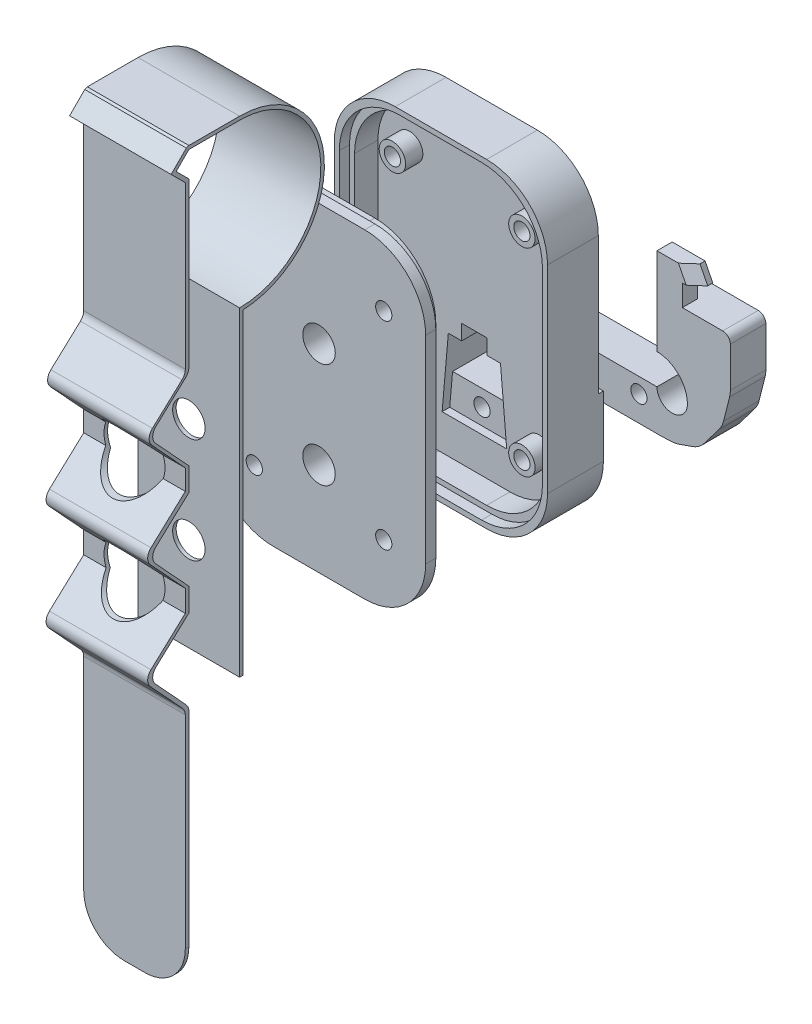
from build123d import *

# Parameters (mm, degrees)
SKETCH_2_W               = 42
SKETCH_2_H               = 63
EXTRUDE_1_DEPTH          = 10
SKETCH_3_W               = 42
SKETCH_3_H               = 24
EXTRUDE_2_DEPTH          = 8
EXTRUDE_3_DEPTH          = 32
SKETCH_5_R               = 0.74
CUT_EXTRUDE_1_DEPTH      = 10
FILLET_1_R               = 3
CUT_EXTRUDE_2_DEPTH      = 7
CUT_EXTRUDE_3_DEPTH      = 7
SKETCH_8_R               = 1.6
CUT_EXTRUDE_4_DEPTH      = 3
FILLET_6_R               = 12
EXTRUDE_START            = -30
SKETCH_10_R              = 1.6
EXTRUDE_7437_DEPTH       = 7
FILLET_2_R               = 1.5
CHAMFER_7825_SIZE        = 1.5
CHAMFER_7825_SIZE_2      = 17.145078454
CUT_EXTRUDE_5_DEPTH      = 6.6
CUT_EXTRUDE_6_DEPTH      = 2
EXTRUDE_START_2          = 20
SKETCH_16_W              = 42
SKETCH_16_H              = 63
EXTRUDE_9_DEPTH          = 4
EXTRUDE_10_DEPTH         = 1
SKETCH_20_W              = 42
SKETCH_20_H              = 63
CUT_EXTRUDE_7_DEPTH      = 2
EXTRUDE_11_DEPTH         = 10
EXTRUDE_11_DEPTH_BACK    = 10
FILLET_3_R               = 2
FILLET_4_R               = 2
CUT_EXTRUDE_8_DEPTH      = 12
CUT_EXTRUDE_8_DEPTH_BACK = 8
SKETCH_22_R              = 6
SKETCH_23_R              = 3.2
CUT_EXTRUDE_10_DEPTH     = 0.7
SKETCH_24_R              = 3.2
CUT_EXTRUDE_11_DEPTH     = 6
FILLET_5_R               = 8
FILLET_7_R               = 12
SKETCH_27_R              = 1.6
CUT_EXTRUDE_13_DEPTH     = 6
SKETCH_28_R              = 1.6
CUT_EXTRUDE_14_DEPTH     = 2
SKETCH_29_R              = 2.6
EXTRUDE_12_DEPTH         = 3.4
SKETCH_32_R              = 1.6
CUT_EXTRUDE_16_DEPTH     = 2.4
CHAMFER_3_SIZE           = 2
EXTRUDE_13_DEPTH         = 1
CUT_EXTRUDE_17_DEPTH     = 11.5
SKETCH_38_W              = 5
SKETCH_38_H              = 5
CUT_EXTRUDE_19_DEPTH     = 3
EXTRUDE_15_DEPTH         = 10
SKETCH_40_R              = 1.6
CUT_EXTRUDE_20_DEPTH     = 10.4
EXTRUDE_16_DEPTH         = 7
EXTRUDE_17_DEPTH         = 7
FILLET_8_R               = 5
SKETCH_43_W              = 4
SKETCH_43_H              = 7.2
CUT_EXTRUDE_21_DEPTH     = 59


with BuildPart() as part:
    # 草图2 → 凸台-拉伸1 (new body)
    with BuildSketch(Plane.XY):
        Rectangle(SKETCH_2_W, SKETCH_2_H)
    extrude(amount=EXTRUDE_1_DEPTH)

    # 草图3 → 凸台-拉伸2 (add)
    with BuildSketch(Plane(origin=(0, 0, 0), x_dir=(-1, 0, 0), z_dir=(0, 0, -1))):
        with Locations((0, -19.5)):
            Rectangle(SKETCH_3_W, SKETCH_3_H)
    extrude(amount=EXTRUDE_2_DEPTH)

    # 草图4 → 凸台-拉伸3 (add)
    with BuildSketch(Plane(origin=(0, -7.5, 0), x_dir=(1, 0, 0), z_dir=(0, 1, 0))):
        Polygon((-3.5, 0), (0, 0), (0, 3), (-5.5, 3), align=None)
        Polygon((0, 3), (0, 0), (3.5, 0), (5.5, 3), align=None)
    extrude(amount=EXTRUDE_3_DEPTH)

    # 草图5 → 切除-拉伸1 (cut)
    with BuildSketch(Plane(origin=(0, -7.5, 0), x_dir=(1, 0, 0), z_dir=(0, 1, 0))):
        with Locations(Location((-3.81, 6.25, 0), (0, 0, 270))):
            Circle(SKETCH_5_R)
        with Locations(Location((-1.27, 6.25, 0), (0, 0, 270))):
            Circle(SKETCH_5_R)
        with Locations(Location((1.27, 6.25, 0), (0, 0, 270))):
            Circle(SKETCH_5_R)
        with Locations(Location((3.81, 6.25, 0), (0, 0, 270))):
            Circle(SKETCH_5_R)
    extrude(amount=-CUT_EXTRUDE_1_DEPTH, mode=Mode.SUBTRACT)

    # 圆角1
    # the kernel refuses this fillet: 3 mm, written as the material it takes off along each edge
    with BuildSketch(Plane(origin=(-9.660251472, 24.5, -9.240377208), x_dir=(0, -1, 0), z_dir=(0.5547001962252293, 0, 0.8320502943378436))) as fillet_1_piece_1_section:
        with BuildLine():
            CenterArc((FILLET_1_R, FILLET_1_R), FILLET_1_R, 180, 90)
            Line((0, FILLET_1_R), (0, 0))
            Line((0, 0), (FILLET_1_R, 0))
        make_face()
    fillet_1_piece_1 = extrude(amount=18.605551275, mode=Mode.PRIVATE)
    fillet_1_piece_1 = split(fillet_1_piece_1, bisect_by=Plane(origin=(-5.864892725, 23.83506759, 0), z_dir=(0, 0, -1)), keep=Keep.TOP, mode=Mode.PRIVATE)
    add(fillet_1_piece_1, mode=Mode.SUBTRACT)
    with BuildSketch(Plane(origin=(-0.660251472, 24.5, 6.240377208), x_dir=(-0.8320502943378437, 0, -0.5547001962252291), z_dir=(0.5547001962252291, 0, -0.8320502943378437))) as fillet_1_piece_2_section:
        with BuildLine():
            CenterArc((FILLET_1_R, -FILLET_1_R), FILLET_1_R, 90, 90)
            Line((0, -FILLET_1_R), (0, 0))
            Line((0, 0), (FILLET_1_R, 0))
        make_face()
    fillet_1_piece_2 = extrude(amount=18.605551275, mode=Mode.PRIVATE)
    fillet_1_piece_2 = split(fillet_1_piece_2, bisect_by=Plane(origin=(5.864892725, 23.83506759, 0), z_dir=(0, 0, -1)), keep=Keep.TOP, mode=Mode.PRIVATE)
    add(fillet_1_piece_2, mode=Mode.SUBTRACT)

    # 草图6 → 切除-拉伸2 (cut)
    with BuildSketch(Plane(origin=(0, 0, -8), x_dir=(-1, 0, 0), z_dir=(0, 0, -1))):
        with BuildLine():
            Line((-17.55, -7.5), (-21, -7.5))
            Line((-21, -7.5), (-21, -17.5))
            Line((-21, -17.5), (-19, -17.5))
            Line((-19, -17.5), (-19, -21.5))
            ThreePointArc((-19, -21.5), (-16.656854249, -27.156854249), (-11, -29.5))
            Line((-11, -29.5), (-9.55, -29.5))
            Line((-9.55, -29.5), (0, -29.5))
            Line((0, -29.5), (9.55, -29.5))
            Line((9.55, -29.5), (11, -29.5))
            ThreePointArc((11, -29.5), (16.656854249, -27.156854249), (19, -21.5))
            Line((19, -21.5), (19, -17.5))
            Line((19, -17.5), (21, -17.5))
            Line((21, -17.5), (21, -7.5))
            Line((21, -7.5), (17.55, -7.5))
            Line((17.55, -7.5), (14.55, -7.5))
            Line((14.55, -7.5), (9.55, -7.5))
            Line((9.55, -7.5), (9.55, -19.5))
            ThreePointArc((9.55, -19.5), (12.378427125, -20.671572875), (13.55, -23.5))
            ThreePointArc((13.55, -23.5), (11.55, -25.5), (9.55, -23.5))
            Line((9.55, -23.5), (0, -23.5))
            Line((0, -23.5), (-9.55, -23.5))
            ThreePointArc((-9.55, -23.5), (-11.55, -25.5), (-13.55, -23.5))
            ThreePointArc((-13.55, -23.5), (-12.378427125, -20.671572875), (-9.55, -19.5))
            Line((-9.55, -19.5), (-9.55, -7.5))
            Line((-9.55, -7.5), (-14.55, -7.5))
            Line((-14.55, -7.5), (-17.55, -7.5))
        make_face()
        with BuildLine():
            Line((-19, -17.5), (-21, -17.5))
            Line((-21, -17.5), (-21, -31.5))
            Line((-21, -31.5), (-9.55, -31.5))
            Line((-9.55, -31.5), (-9.55, -29.5))
            Line((-9.55, -29.5), (-11, -29.5))
            ThreePointArc((-11, -29.5), (-16.656854249, -27.156854249), (-19, -21.5))
            Line((-19, -21.5), (-19, -17.5))
        make_face()
        with BuildLine():
            Line((9.55, -29.5), (9.55, -31.5))
            Line((9.55, -31.5), (21, -31.5))
            Line((21, -31.5), (21, -17.5))
            Line((21, -17.5), (19, -17.5))
            Line((19, -17.5), (19, -21.5))
            ThreePointArc((19, -21.5), (16.656854249, -27.156854249), (11, -29.5))
            Line((11, -29.5), (9.55, -29.5))
        make_face()
        Polygon((-9.55, -29.5), (-9.55, -31.5), (9.55, -31.5), (9.55, -29.5), (0, -29.5), align=None)
    extrude(amount=-CUT_EXTRUDE_2_DEPTH, mode=Mode.SUBTRACT)

    # 草图7 → 切除-拉伸3 (cut)
    with BuildSketch(Plane(origin=(0, 0, -8), x_dir=(-1, 0, 0), z_dir=(0, 0, -1))):
        with BuildLine():
            Line((-7.55, -7.5), (-9.55, -7.5))
            Line((-9.55, -7.5), (-9.55, -19.5))
            ThreePointArc((-9.55, -19.5), (-12.378427125, -20.671572875), (-13.55, -23.5))
            ThreePointArc((-13.55, -23.5), (-12.964213562, -24.914213562), (-11.55, -25.5))
            ThreePointArc((-11.55, -25.5), (-10.135786438, -24.914213562), (-9.55, -23.5))
            Line((-9.55, -23.5), (-7.55, -23.5))
            Line((-7.55, -23.5), (-7.55, -7.5))
        make_face()
        with BuildLine():
            Line((9.55, -7.5), (7.55, -7.5))
            Line((7.55, -7.5), (7.55, -23.5))
            Line((7.55, -23.5), (9.55, -23.5))
            ThreePointArc((9.55, -23.5), (10.135786438, -24.914213562), (11.55, -25.5))
            ThreePointArc((11.55, -25.5), (12.964213562, -24.914213562), (13.55, -23.5))
            ThreePointArc((13.55, -23.5), (12.378427125, -20.671572875), (9.55, -19.5))
            Line((9.55, -19.5), (9.55, -7.5))
        make_face()
    extrude(amount=-CUT_EXTRUDE_3_DEPTH, mode=Mode.SUBTRACT)

    # 草图8 → 切除-拉伸4 (cut)
    with BuildSketch(Plane(origin=(0, 0, -1), x_dir=(-1, 0, 0), z_dir=(0, 0, -1))):
        with Locations((-6, -26.5)):
            Circle(SKETCH_8_R)
        with Locations((6, -26.5)):
            Circle(SKETCH_8_R)
    extrude(amount=-CUT_EXTRUDE_4_DEPTH, mode=Mode.SUBTRACT)

    # 圆角6
    fillet_6_edges = [part.edges().sort_by_distance(p)[0] for p in [
        (21, -31.5, 4.5),
        (-21, -31.5, 4.5),
        (-21, 31.5, 5),
        (21, 31.5, 5),
    ]]
    fillet(fillet_6_edges, radius=FILLET_6_R)

    # Chamfer 7825
    # the kernel refuses this chamfer: 17.145078454, 1.5 mm, written as the material it takes off along each edge
    with BuildSketch(Plane(origin=(7.55, -7.5, -52.570930251), x_dir=(-0.9159861691531067, 0.4012098427509178, 0), z_dir=(0, 0, 1))) as chamfer_7825_piece_1:
        Polygon((CHAMFER_7825_SIZE * 0.915986169153, CHAMFER_7825_SIZE * 0.401209842751), (-CHAMFER_7825_SIZE_2 * 0.401209842754, CHAMFER_7825_SIZE_2 * 0.915986169161), (0, 0), align=None)
    extrude(amount=51.570930251, mode=Mode.SUBTRACT)
    with BuildSketch(Plane(origin=(-7.55, -7.5, -52.570930251), x_dir=(0.9159861691531067, 0.4012098427509178, 0), z_dir=(0, 0, 1))) as chamfer_7825_piece_2:
        Polygon((CHAMFER_7825_SIZE * 0.915986169153, -CHAMFER_7825_SIZE * 0.401209842751), (-CHAMFER_7825_SIZE_2 * 0.401209842754, -CHAMFER_7825_SIZE_2 * 0.915986169161), (0, 0), align=None)
    extrude(amount=51.570930251, mode=Mode.SUBTRACT)

    # 草图14 → 切除-拉伸5 (cut)
    with BuildSketch(Plane.XY.offset(10)):
        with BuildLine():
            Line((-7, -29.5), (7, -29.5))
            ThreePointArc((7, -29.5), (15.485281374, -25.985281374), (19, -17.5))
            Line((19, -17.5), (19, 17.5))
            ThreePointArc((19, 17.5), (15.485281374, 25.985281374), (7, 29.5))
            Line((7, 29.5), (-7, 29.5))
            ThreePointArc((-7, 29.5), (-15.485281374, 25.985281374), (-19, 17.5))
            Line((-19, 17.5), (-19, -17.5))
            ThreePointArc((-19, -17.5), (-15.485281374, -25.985281374), (-7, -29.5))
        make_face()
    extrude(amount=-CUT_EXTRUDE_5_DEPTH, mode=Mode.SUBTRACT)

    # 草图15 → 切除-拉伸6 (cut)
    with BuildSketch(Plane.XY.offset(10)):
        with BuildLine():
            Line((-8, -30.5), (8, -30.5))
            ThreePointArc((8, -30.5), (16.485281374, -26.985281374), (20, -18.5))
            Line((20, -18.5), (20, 18.5))
            ThreePointArc((20, 18.5), (16.485281374, 26.985281374), (8, 30.5))
            Line((8, 30.5), (-8, 30.5))
            ThreePointArc((-8, 30.5), (-16.485281374, 26.985281374), (-20, 18.5))
            Line((-20, 18.5), (-20, -18.5))
            ThreePointArc((-20, -18.5), (-16.485281374, -26.985281374), (-8, -30.5))
        make_face()
    extrude(amount=-CUT_EXTRUDE_6_DEPTH, mode=Mode.SUBTRACT)

    # 草图28 → 切除-拉伸14 (cut)
    with BuildSketch(Plane.XY.offset(3.4)):
        with Locations((-12.75, 19.525931249)):
            Circle(SKETCH_28_R)
        with Locations((12.75, 19.525931249)):
            Circle(SKETCH_28_R)
        with Locations((12.75, -19.5)):
            Circle(SKETCH_28_R)
        with Locations((-12.75, -19.5)):
            Circle(SKETCH_28_R)
    extrude(amount=-CUT_EXTRUDE_14_DEPTH, mode=Mode.SUBTRACT)

    # 草图29 → 凸台-拉伸12 (add)
    with BuildSketch(Plane.XY.offset(3.4)):
        with Locations(Location((12.75, 19.525931249, 0), (0, 0, 180))):
            Circle(SKETCH_29_R)
        with Locations(Location((-12.75, 19.525931249, 0), (0, 0, 180))):
            Circle(SKETCH_29_R)
        with Locations(Location((-12.75, -19.5, 0), (0, 0, 180))):
            Circle(SKETCH_29_R)
        with Locations(Location((12.75, -19.5, 0), (0, 0, 180))):
            Circle(SKETCH_29_R)
    extrude(amount=EXTRUDE_12_DEPTH)

    # 草图32 → 切除-拉伸16 (cut)
    with BuildSketch(Plane.XY.offset(6.8)):
        with Locations((-12.75, 19.525931249)):
            Circle(SKETCH_32_R)
        with Locations((12.75, 19.525931249)):
            Circle(SKETCH_32_R)
        with Locations((12.75, -19.5)):
            Circle(SKETCH_32_R)
        with Locations((-12.75, -19.5)):
            Circle(SKETCH_32_R)
    extrude(amount=-CUT_EXTRUDE_16_DEPTH, mode=Mode.SUBTRACT)

    # 草图35 → 凸台-拉伸13 (add)
    with BuildSketch(Plane(origin=(0, 0, -8), x_dir=(-1, 0, 0), z_dir=(0, 0, -1))):
        Polygon((-6.05, -7.5), (-7.449818616, -23.5), (7.449818616, -23.5), (6.05, -7.5), align=None)
    extrude(amount=EXTRUDE_13_DEPTH)

    # 草图36 → 切除-拉伸17 (cut)
    with BuildSketch(Plane.XY.offset(3.4)):
        Polygon((6.358510115, -22.5), (5.133668826, -8.5), (-5.133668826, -8.5), (-6.358510115, -22.5), align=None)
    extrude(amount=-CUT_EXTRUDE_17_DEPTH, mode=Mode.SUBTRACT)

    # 草图38 → 切除-拉伸19 (cut)
    with BuildSketch(Plane(origin=(0, -8.5, 0), x_dir=(-1, 0, 0), z_dir=(0, -1, 0))):
        with Locations((0, -0.9)):
            Rectangle(SKETCH_38_W, SKETCH_38_H)
    extrude(amount=-CUT_EXTRUDE_19_DEPTH, mode=Mode.SUBTRACT)

    # 草图39 → 凸台-拉伸15 (add)
    with BuildSketch(Plane.XY.offset(-8.1)):
        Polygon((0, -16.1), (5.798582669, -16.1), (6.358510115, -22.5), (-6.358510115, -22.5), (-5.798582669, -16.1), align=None)
    extrude(amount=EXTRUDE_15_DEPTH)

    # 草图40 → 切除-拉伸20 (cut)
    with BuildSketch(Plane.XY.offset(1.9)):
        with Locations((0, -19.3)):
            Circle(SKETCH_40_R)
    extrude(amount=-CUT_EXTRUDE_20_DEPTH, mode=Mode.SUBTRACT)


with BuildPart() as body_2:
    # 草图10 → Extrude 7437 (new body)
    with BuildSketch(Plane.XY.offset(EXTRUDE_START)):
        with BuildLine():
            Line((-24, -17.5), (-19, -17.5))
            Line((-19, -17.5), (-19, -21.5))
            ThreePointArc((-19, -21.5), (-16.656854249, -27.156854249), (-11, -29.5))
            Line((-11, -29.5), (11, -29.5))
            ThreePointArc((11, -29.5), (16.656854249, -27.156854249), (19, -21.5))
            Line((19, -21.5), (19, -17.5))
            Line((19, -17.5), (24, -17.5))
            Line((24, -17.5), (24, -7.5))
            Line((24, -7.5), (14.55, -7.5))
            Line((14.55, -7.5), (14.55, -3.3))
            Line((14.55, -3.3), (17.55, -3.3))
            Line((17.55, -3.3), (16.031012658, -0.3))
            Line((16.031012658, -0.3), (9.55, -0.3))
            Line((9.55, -0.3), (9.55, -17.5))
            ThreePointArc((9.55, -17.5), (13.792640687, -19.257359313), (15.55, -23.5))
            ThreePointArc((15.55, -23.5), (12.55, -26.5), (9.55, -23.5))
            Line((9.55, -23.5), (-9.55, -23.5))
            ThreePointArc((-9.55, -23.5), (-12.55, -26.5), (-15.55, -23.5))
            ThreePointArc((-15.55, -23.5), (-13.792640687, -19.257359313), (-9.55, -17.5))
            Line((-9.55, -17.5), (-9.55, -0.3))
            Line((-9.55, -0.3), (-16.031012658, -0.3))
            Line((-16.031012658, -0.3), (-17.55, -3.3))
            Line((-17.55, -3.3), (-14.55, -3.3))
            Line((-14.55, -3.3), (-14.55, -7.5))
            Line((-14.55, -7.5), (-24, -7.5))
            Line((-24, -7.5), (-24, -17.5))
        make_face()
        with Locations((6, -26.5)):
            Circle(SKETCH_10_R, mode=Mode.SUBTRACT)
        with Locations((-6, -26.5)):
            Circle(SKETCH_10_R, mode=Mode.SUBTRACT)
    extrude(amount=EXTRUDE_7437_DEPTH)

    # 圆角2
    fillet_2_edges = [body_2.edges().sort_by_distance(p)[0] for p in [
        (24, -7.5, -26.5),
        (-24, -7.5, -26.5),
    ]]
    fillet(fillet_2_edges, radius=FILLET_2_R)

    # 倒角3
    chamfer_3_edges = [body_2.edges().sort_by_distance(p)[0] for p in [
        (16.790506329, -1.8, -23),
        (-16.790506329, -1.8, -23),
    ]]
    chamfer(chamfer_3_edges, length=CHAMFER_3_SIZE)

    # 草图41 → 凸台-拉伸16 (add)
    with BuildSketch(Plane(origin=(0, 0, -30), x_dir=(-1, 0, 0), z_dir=(0, 0, -1))):
        with BuildLine():
            Line((19, -17.5), (21, -17.5))
            Line((21, -17.5), (21, -19.5))
            ThreePointArc((21, -19.5), (17.485281374, -27.985281374), (9, -31.5))
            Line((9, -31.5), (-9, -31.5))
            ThreePointArc((-9, -31.5), (-17.485281374, -27.985281374), (-21, -19.5))
            Line((-21, -19.5), (-21, -17.5))
            Line((-21, -17.5), (-19, -17.5))
            Line((-19, -17.5), (-19, -21.5))
            ThreePointArc((-19, -21.5), (-16.656854249, -27.156854249), (-11, -29.5))
            Line((-11, -29.5), (11, -29.5))
            ThreePointArc((11, -29.5), (16.656854249, -27.156854249), (19, -21.5))
            Line((19, -21.5), (19, -17.5))
        make_face()
    extrude(amount=-EXTRUDE_16_DEPTH)

    # 草图42 → 凸台-拉伸17 (add)
    with BuildSketch(Plane(origin=(0, 0, -30), x_dir=(-1, 0, 0), z_dir=(0, 0, -1))):
        with BuildLine():
            Line((-24, -17.5), (-22.41611674, -23.813047794))
            Line((-22.41611674, -23.813047794), (-17.932456929, -29.720928958))
            Line((-17.932456929, -29.720928958), (-13.079554544, -31.408895004))
            Line((-13.079554544, -31.408895004), (-10, -31.5))
            Line((-10, -31.5), (-9, -31.5))
            ThreePointArc((-9, -31.5), (-17.485281374, -27.985281374), (-21, -19.5))
            Line((-21, -19.5), (-21, -17.5))
            Line((-21, -17.5), (-24, -17.5))
        make_face()
    extrude(amount=-EXTRUDE_17_DEPTH)

    # 圆角8
    fillet_8_edges = [body_2.edges().sort_by_distance(p)[0] for p in [
        (13.079554544, -31.408895004, -26.5),
        (17.932456929, -29.720928958, -26.5),
        (22.41611674, -23.813047794, -26.5),
        (24, -17.5, -26.5),
    ]]
    fillet(fillet_8_edges, radius=FILLET_8_R)

    # 草图43 → 切除-拉伸21 (cut)
    with BuildSketch(Plane(origin=(24, 0, 0), x_dir=(0, 0, -1), z_dir=(1, 0, 0))):
        with Locations((28, -3.9)):
            Rectangle(SKETCH_43_W, SKETCH_43_H)
    extrude(amount=-CUT_EXTRUDE_21_DEPTH, mode=Mode.SUBTRACT)


with BuildPart() as body_3:
    # 草图16 → 凸台-拉伸9 (new body)
    with BuildSketch(Plane.XY.offset(10).offset(EXTRUDE_START_2)):
        Rectangle(SKETCH_16_W, SKETCH_16_H)
    extrude(amount=EXTRUDE_9_DEPTH)

    # 草图19 → 凸台-拉伸10 (add)
    with BuildSketch(Plane(origin=(0, 0, 30), x_dir=(-1, 0, 0), z_dir=(0, 0, -1))):
        with BuildLine():
            Line((-6, -28.5), (6, -28.5))
            ThreePointArc((6, -28.5), (14.485281374, -24.985281374), (18, -16.5))
            Line((18, -16.5), (18, 16.5))
            ThreePointArc((18, 16.5), (14.485281374, 24.985281374), (6, 28.5))
            Line((6, 28.5), (-6, 28.5))
            ThreePointArc((-6, 28.5), (-14.485281374, 24.985281374), (-18, 16.5))
            Line((-18, 16.5), (-18, -16.5))
            ThreePointArc((-18, -16.5), (-14.485281374, -24.985281374), (-6, -28.5))
        make_face()
    extrude(amount=EXTRUDE_10_DEPTH)

    # 草图20 → 切除-拉伸7 (cut)
    with BuildSketch(Plane(origin=(0, 0, 30), x_dir=(-1, 0, 0), z_dir=(0, 0, -1))):
        Rectangle(SKETCH_20_W, SKETCH_20_H)
        with BuildLine():
            Line((-7, -30.5), (7, -30.5))
            ThreePointArc((7, -30.5), (15.485281374, -26.985281374), (19, -18.5))
            Line((19, -18.5), (19, 18.5))
            ThreePointArc((19, 18.5), (15.485281374, 26.985281374), (7, 30.5))
            Line((7, 30.5), (-7, 30.5))
            ThreePointArc((-7, 30.5), (-15.485281374, 26.985281374), (-19, 18.5))
            Line((-19, 18.5), (-19, -18.5))
            ThreePointArc((-19, -18.5), (-15.485281374, -26.985281374), (-7, -30.5))
        make_face(mode=Mode.SUBTRACT)
    extrude(amount=-CUT_EXTRUDE_7_DEPTH, mode=Mode.SUBTRACT)

    # 草图24 → 切除-拉伸11 (cut)
    with BuildSketch(Plane.XY.offset(34)):
        with Locations((0, 7.555855621)):
            Circle(SKETCH_24_R)
        with Locations((0, -13.112379601)):
            Circle(SKETCH_24_R)
    extrude(amount=-CUT_EXTRUDE_11_DEPTH, mode=Mode.SUBTRACT)

    # 圆角7
    fillet_7_edges = [body_3.edges().sort_by_distance(p)[0] for p in [
        (21, -31.5, 33),
        (-21, -31.5, 33),
        (-21, 31.5, 33),
        (21, 31.5, 33),
    ]]
    fillet(fillet_7_edges, radius=FILLET_7_R)

    # 草图27 → 切除-拉伸13 (cut)
    with BuildSketch(Plane.XY.offset(34)):
        with Locations((-12.75, 19.525931249)):
            Circle(SKETCH_27_R)
        with Locations((12.75, 19.525931249)):
            Circle(SKETCH_27_R)
        with Locations((12.75, -19.5)):
            Circle(SKETCH_27_R)
        with Locations((-12.75, -19.5)):
            Circle(SKETCH_27_R)
    extrude(amount=-CUT_EXTRUDE_13_DEPTH, mode=Mode.SUBTRACT)


with BuildPart() as body_4:
    # 草图21 → 凸台-拉伸11 (new, two sides: drawn at the far end of the back side and taken through both)
    with BuildSketch(Plane(origin=(0, 0, 0), x_dir=(0, 0, -1), z_dir=(1, 0, 0)).offset(-EXTRUDE_11_DEPTH_BACK)):
        with BuildLine():
            Line((-59.6372278, -31.5), (-59.6372278, 31.5))
            ThreePointArc((-59.6372278, 31.5), (-43.641058217, 47.14991619), (-58.9372278, 63.484680166))
            Line((-58.9372278, 63.484680166), (-59.6372278, 63.5))
            Line((-59.6372278, 63.5), (-69.6372278, 63.5))
            Line((-69.6372278, 63.5), (-72.1372278, 61))
            Line((-72.1372278, 61), (-69.6372278, 58.5))
            Line((-69.6372278, 58.5), (-69.6372278, 25.5))
            Line((-69.6372278, 25.5), (-77.579345381, 18.179037109))
            Line((-77.579345381, 18.179037109), (-69.6372278, 9.563062324))
            Line((-69.6372278, 9.563062324), (-69.6372278, 4.968468838))
            Line((-69.6372278, 4.968468838), (-77.579345381, -2.352494053))
            Line((-77.579345381, -2.352494053), (-69.6372278, -10.968468838))
            Line((-69.6372278, -10.968468838), (-69.6372278, -15.563062324))
            Line((-69.6372278, -15.563062324), (-77.579345381, -22.884025215))
            Line((-77.579345381, -22.884025215), (-69.6372278, -31.5))
            Line((-69.6372278, -31.5), (-69.6372278, -80.5))
            Line((-69.6372278, -80.5), (-70.3372278, -80.5))
            Line((-70.3372278, -80.5), (-70.3372278, -31.773408119))
            Line((-70.3372278, -31.773408119), (-78.56847611, -22.843771009))
            Line((-78.56847611, -22.843771009), (-70.3372278, -15.256290364))
            Line((-70.3372278, -15.256290364), (-70.3372278, -10.968468838))
            Line((-70.3372278, -10.968468838), (-78.56847611, -2.038831728))
            Line((-78.56847611, -2.038831728), (-70.3372278, 5.548648917))
            Line((-70.3372278, 5.548648917), (-70.3372278, 9.563062324))
            Line((-70.3372278, 9.563062324), (-78.279345381, 18.179037109))
            Line((-78.279345381, 18.179037109), (-70.3372278, 25.5))
            Line((-70.3372278, 25.5), (-70.3372278, 58.210050506))
            Line((-70.3372278, 58.210050506), (-73.127177293, 61))
            Line((-73.127177293, 61), (-70.132202547, 63.994974747))
            Line((-70.132202547, 63.994974747), (-69.6372278, 64.2))
            Line((-69.6372278, 64.2), (-59.6372278, 64.2))
            ThreePointArc((-59.6372278, 64.2), (-42.94089748, 47.850076926), (-58.9372278, 30.814677108))
            Line((-58.9372278, 30.814677108), (-58.9372278, -31.5))
            Line((-58.9372278, -31.5), (-59.6372278, -31.5))
        make_face()
    extrude(amount=EXTRUDE_11_DEPTH + EXTRUDE_11_DEPTH_BACK)

    # 圆角3
    fillet_3_edges = [body_4.edges().sort_by_distance(p)[0] for p in [
        (0, 18.179037109, 77.579345381),
        (0, -2.352494053, 77.579345381),
        (0, -22.884025215, 77.579345381),
    ]]
    fillet(fillet_3_edges, radius=FILLET_3_R)

    # 圆角4
    fillet_4_edges = [body_4.edges().sort_by_distance(p)[0] for p in [
        (0, 25.5, 69.6372278),
        (0, -31.5, 69.6372278),
        (0, -31.773408119, 70.3372278),
        (0, -22.843771009, 78.56847611),
        (0, -2.038831728, 78.56847611),
        (0, 18.179037109, 78.279345381),
        (0, 25.5, 70.3372278),
    ]]
    fillet(fillet_4_edges, radius=FILLET_4_R)

    # 草图22 → 切除-拉伸8 (cut, two sides: drawn at the far end of the back side and taken through both)
    with BuildSketch(Plane.XY.offset(70.3372278).offset(-CUT_EXTRUDE_8_DEPTH_BACK)):
        with Locations(Location((0, 7.555855621, 0), (0, 0, 160.45576938))):
            Circle(SKETCH_22_R)
        with Locations(Location((0, -13.112379601, 0), (0, 0, 159.064395454))):
            Circle(SKETCH_22_R)
    extrude(amount=CUT_EXTRUDE_8_DEPTH + CUT_EXTRUDE_8_DEPTH_BACK, mode=Mode.SUBTRACT)

    # 草图23 → 切除-拉伸10 (cut)
    with BuildSketch(Plane.XY.offset(59.6372278)):
        with Locations((0, 7.555855621)):
            Circle(SKETCH_23_R)
        with Locations((0, -13.112379601)):
            Circle(SKETCH_23_R)
    extrude(amount=-CUT_EXTRUDE_10_DEPTH, mode=Mode.SUBTRACT)

    # 圆角5
    fillet_5_edges = [body_4.edges().sort_by_distance(p)[0] for p in [
        (-10, -80.5, 69.9872278),
        (10, -80.5, 69.9872278),
    ]]
    fillet(fillet_5_edges, radius=FILLET_5_R)


solid = Compound([part.part, body_2.part, body_3.part, body_4.part])
